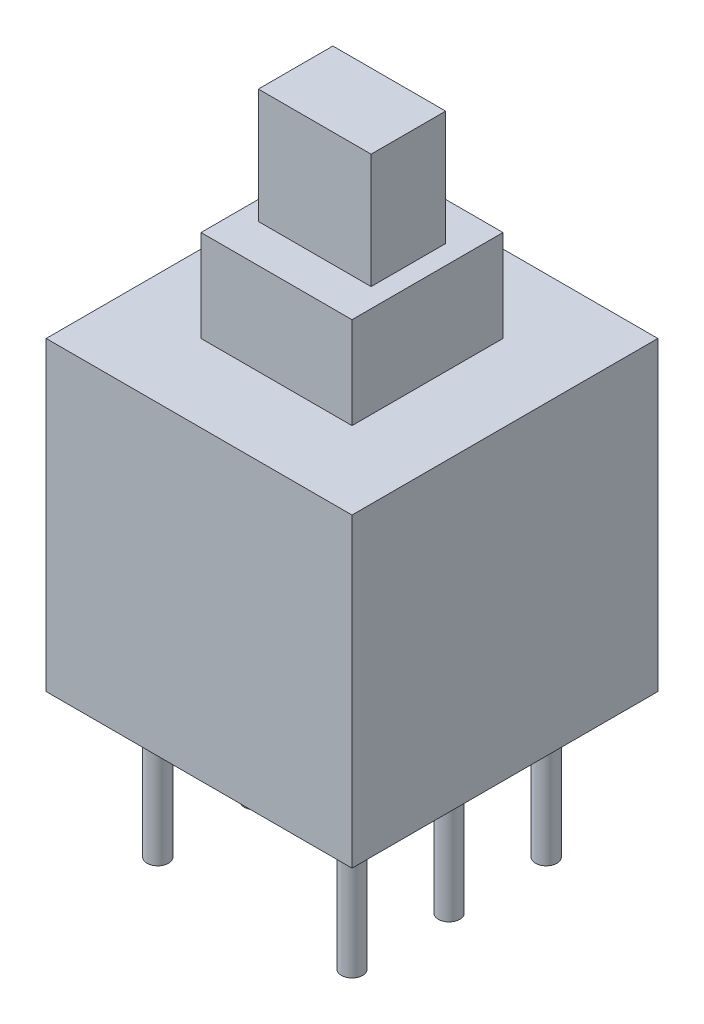
from build123d import *

# Parameters (mm, degrees)
SKETCH1_W           = 8
SKETCH1_H           = 8
BOSS_EXTRUDE1_DEPTH = 8
SKETCH2_W           = 3.95
SKETCH2_H           = 3.95
BOSS_EXTRUDE2_DEPTH = 2.4
SKETCH3_W           = 2.95
SKETCH3_H           = 1.95
BOSS_EXTRUDE3_DEPTH = 3
SKETCH4_R           = 0.28
BOSS_EXTRUDE4_DEPTH = 3.75


with BuildPart() as part:
    # Sketch1 → Boss-Extrude1 (new body)
    with BuildSketch(Plane(origin=(0, 0, 0), x_dir=(1, 0, 0), z_dir=(0, 1, 0))):
        Rectangle(SKETCH1_W, SKETCH1_H)
    extrude(amount=BOSS_EXTRUDE1_DEPTH)

    # Sketch2 → Boss-Extrude2 (add)
    with BuildSketch(Plane(origin=(0, 8, 0), x_dir=(1, 0, 0), z_dir=(0, 1, 0))):
        Rectangle(SKETCH2_W, SKETCH2_H)
    extrude(amount=BOSS_EXTRUDE2_DEPTH)

    # Sketch3 → Boss-Extrude3 (add)
    with BuildSketch(Plane(origin=(0, 10.4, 0), x_dir=(1, 0, 0), z_dir=(0, 1, 0))):
        Rectangle(SKETCH3_W, SKETCH3_H)
    extrude(amount=BOSS_EXTRUDE3_DEPTH)

    # Sketch4 → Boss-Extrude4 (add)
    with BuildSketch(Plane.XZ):
        with Locations((2.54, 2.54)):
            Circle(SKETCH4_R)
        with Locations((2.54, 0)):
            Circle(SKETCH4_R)
        with Locations((2.54, -2.54)):
            Circle(SKETCH4_R)
        with Locations((-2.54, -2.54)):
            Circle(SKETCH4_R)
        with Locations((-2.54, 0)):
            Circle(SKETCH4_R)
        with Locations((-2.54, 2.54)):
            Circle(SKETCH4_R)
    extrude(amount=BOSS_EXTRUDE4_DEPTH)


solid = part.part
